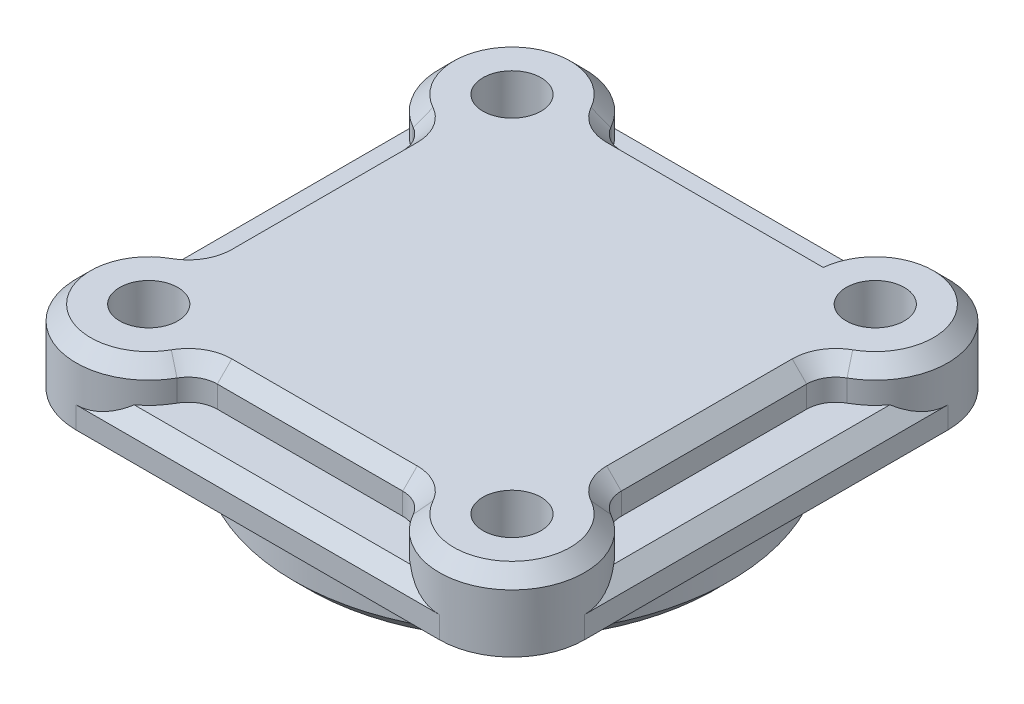
from build123d import *

# Parameters (mm, degrees)
BOSS_EXTRUDE1_DEPTH = 3.175
BOSS_EXTRUDE2_DEPTH = 3.175
SKETCH3_R           = 19.05
SKETCH3_R_2         = 15.875
BOSS_EXTRUDE3_DEPTH = 6.35
SKETCH4_R           = 2.54
CUT_EXTRUDE1_DEPTH  = 34.89972345
CHAMFER1_SIZE       = 1.27


with BuildPart() as part:
    # Sketch1 → Boss-Extrude1 (new body)
    with BuildSketch(Plane(origin=(0, 0, 0), x_dir=(1, 0, 0), z_dir=(0, 1, 0))):
        with BuildLine():
            Line((-15.875, -22.225), (15.875, -22.225))
            ThreePointArc((15.875, -22.225), (20.365128061, -20.365128061), (22.225, -15.875))
            Line((22.225, -15.875), (22.225, 15.875))
            ThreePointArc((22.225, 15.875), (20.365128061, 20.365128061), (15.875, 22.225))
            Line((15.875, 22.225), (-15.875, 22.225))
            ThreePointArc((-15.875, 22.225), (-20.365128061, 20.365128061), (-22.225, 15.875))
            Line((-22.225, 15.875), (-22.225, -15.875))
            ThreePointArc((-22.225, -15.875), (-20.365128061, -20.365128061), (-15.875, -22.225))
        make_face()
    extrude(amount=BOSS_EXTRUDE1_DEPTH)

    # Sketch2 → Boss-Extrude2 (add)
    with BuildSketch(Plane(origin=(0, 3.175, 0), x_dir=(1, 0, 0), z_dir=(0, 1, 0))):
        with BuildLine():
            Line((9.779188038, 17.653644576), (-8.104452463, 17.653644576))
            ThreePointArc((-8.104452463, 17.653644576), (-9.392376749, 18.004386475), (-10.324608902, 18.959746126))
            ThreePointArc((-10.324608902, 18.959746126), (-12.655189283, 21.348145252), (-15.875, 22.225))
            ThreePointArc((-15.875, 22.225), (-20.365128061, 20.365128061), (-22.225, 15.875))
            ThreePointArc((-22.225, 15.875), (-21.348011707, 12.654962289), (-18.959285714, 10.324353044))
            ThreePointArc((-18.959285714, 10.324353044), (-18.003795317, 9.392109345), (-17.653, 8.104094261))
            Line((-17.653, 8.104094261), (-17.653, -8.104094261))
            ThreePointArc((-17.653, -8.104094261), (-18.003795317, -9.392109345), (-18.959285714, -10.324353044))
            ThreePointArc((-18.959285714, -10.324353044), (-21.348011707, -12.654962289), (-22.225, -15.875))
            ThreePointArc((-22.225, -15.875), (-20.365128061, -20.365128061), (-15.875, -22.225))
            ThreePointArc((-15.875, -22.225), (-12.655189283, -21.348145252), (-10.324608902, -18.959746126))
            ThreePointArc((-10.324608902, -18.959746126), (-9.392376749, -18.004386475), (-8.104452463, -17.653644576))
            Line((-8.104452463, -17.653644576), (8.104452463, -17.653644576))
            ThreePointArc((8.104452463, -17.653644576), (9.392376749, -18.004386475), (10.324608902, -18.959746126))
            ThreePointArc((10.324608902, -18.959746126), (12.655189283, -21.348145252), (15.875, -22.225))
            ThreePointArc((15.875, -22.225), (20.365128061, -20.365128061), (22.225, -15.875))
            ThreePointArc((22.225, -15.875), (21.348011707, -12.654962289), (18.959285714, -10.324353044))
            ThreePointArc((18.959285714, -10.324353044), (18.003795317, -9.392109345), (17.653, -8.104094261))
            Line((17.653, -8.104094261), (17.653, 8.104094261))
            ThreePointArc((17.653, 8.104094261), (18.003795317, 9.392109345), (18.959285714, 10.324353044))
            ThreePointArc((18.959285714, 10.324353044), (21.348011707, 12.654962289), (22.225, 15.875))
            ThreePointArc((22.225, 15.875), (20.365128061, 20.365128061), (15.875, 22.225))
            ThreePointArc((15.875, 22.225), (12.065268583, 20.955201426), (9.779188038, 17.653644576))
        make_face()
    extrude(amount=BOSS_EXTRUDE2_DEPTH)

    # Sketch3 → Boss-Extrude3 (add)
    with BuildSketch(Plane.XZ):
        with Locations(Location((0, 0, 0), (0, 0, 90))):
            Circle(SKETCH3_R)
        with Locations(Location((0, 0, 0), (0, 0, 270))):
            Circle(SKETCH3_R_2, mode=Mode.SUBTRACT)
    extrude(amount=BOSS_EXTRUDE3_DEPTH)

    # Sketch4 → Cut-Extrude1 (cut, through all)
    with BuildSketch(Plane(origin=(0, 6.35, 0), x_dir=(1, 0, 0), z_dir=(0, 1, 0))):
        with Locations(Location((-15.875, 15.875, 0), (0, 0, 270))):
            Circle(SKETCH4_R)
        with Locations(Location((15.875, 15.875, 0), (0, 0, 270))):
            Circle(SKETCH4_R)
        with Locations(Location((-15.875, -15.875, 0), (0, 0, 270))):
            Circle(SKETCH4_R)
        with Locations(Location((15.875, -15.875, 0), (0, 0, 270))):
            Circle(SKETCH4_R)
    extrude(amount=-CUT_EXTRUDE1_DEPTH, mode=Mode.SUBTRACT)

    # Chamfer1
    chamfer1_edges = [part.edges().sort_by_distance(p)[0] for p in [
        (-20.365314283, 6.35, -20.36494183),
        (-20.365314283, 6.35, 20.36494183),
        (-9.392376749, 6.35, -18.004386475),
        (19.836937806, 6.35, -20.837413609),
        (0.837367788, 6.35, -17.653644576),
        (18.003795317, 6.35, -9.392109345),
        (17.653, 6.35, 0),
        (18.003795317, 6.35, 9.392109345),
        (-18.003795317, 6.35, -9.392109345),
        (20.365314283, 6.35, 20.36494183),
        (-17.653, 6.35, 0),
        (9.392376749, 6.35, 18.004386475),
        (-18.003795317, 6.35, 9.392109345),
        (0, 6.35, 17.653644576),
        (-9.392376749, 6.35, 18.004386475),
    ]]
    chamfer(chamfer1_edges, length=CHAMFER1_SIZE)
    chamfer1_2_edges = [part.edges().sort_by_distance(p)[0] for p in [
        (0, -6.35, -19.05),
    ]]
    chamfer(chamfer1_2_edges, length=CHAMFER1_SIZE)
    chamfer1_3_edges = [part.edges().sort_by_distance(p)[0] for p in [
        (0, -6.35, 15.875),
    ]]
    chamfer(chamfer1_3_edges, length=CHAMFER1_SIZE)
    # the kernel refuses this chamfer: 1.27 mm, written as the material it takes off along each edge
    with BuildSketch(Plane(origin=(-22.225, 3.175, -19.141037395), x_dir=(-0.02749587661058728, -0.9996219169112966, 0), z_dir=(0, 0, 1))) as chamfer1_4_piece_1_section:
        with BuildLine():
            Line((1.306414958, 0), (-0.071814887, 1.304439598))
            Line((-0.071814887, 1.304439598), (-0.097205283, 1.303741203))
            ThreePointArc((-0.097205283, 1.303741203), (-0.043344118, 0.652015244), (-0.025390397, -0.000698395))
            Line((-0.025390397, -0.000698395), (0.000698395, -0.025390397))
            ThreePointArc((0.000698395, -0.025390397), (0.653412034, -0.007436675), (1.307113353, -0.025390397))
            Line((1.307113353, -0.025390397), (1.306414958, 0))
        make_face()
    chamfer1_4_piece_1 = extrude(amount=38.282074789, mode=Mode.PRIVATE)
    chamfer1_4_piece_1 = chamfer1_4_piece_1 - Plane(origin=(-15.875, 2.735416382, -15.875), x_dir=(0, 0, -1), z_dir=(0, -1, 0)) * Cylinder(6.35, 82, mode=Mode.PRIVATE)
    chamfer1_4_piece_1 = chamfer1_4_piece_1 - Plane(origin=(-15.875, 2.735416382, 15.875), x_dir=(-1, 0, 0), z_dir=(0, -1, 0)) * Cylinder(6.35, 82, mode=Mode.PRIVATE)
    add(chamfer1_4_piece_1, mode=Mode.SUBTRACT)
    # the kernel refuses this chamfer: 1.27 mm, written as the material it takes off along each edge
    with BuildSketch(Plane(origin=(19.141037395, 3.175, -22.225), x_dir=(0, -0.9996219169112966, -0.02749587661058728), z_dir=(-1, 0, 0))) as chamfer1_5_piece_1_section:
        with BuildLine():
            Line((1.306414958, 0), (-0.071814887, 1.304439598))
            Line((-0.071814887, 1.304439598), (-0.097205283, 1.303741203))
            ThreePointArc((-0.097205283, 1.303741203), (-0.043344118, 0.652015244), (-0.025390397, -0.000698395))
            Line((-0.025390397, -0.000698395), (0.000698395, -0.025390397))
            ThreePointArc((0.000698395, -0.025390397), (0.653412034, -0.007436675), (1.307113353, -0.025390397))
            Line((1.307113353, -0.025390397), (1.306414958, 0))
        make_face()
    chamfer1_5_piece_1 = extrude(amount=38.282074789, mode=Mode.PRIVATE)
    chamfer1_5_piece_1 = chamfer1_5_piece_1 - Plane(origin=(-15.875, 2.735416382, -15.875), x_dir=(0, 0, -1), z_dir=(0, -1, 0)) * Cylinder(6.35, 82, mode=Mode.PRIVATE)
    chamfer1_5_piece_1 = chamfer1_5_piece_1 - Plane(origin=(15.875, 2.735416382, -15.875), x_dir=(1, 0, 0), z_dir=(0, -1, 0)) * Cylinder(6.35, 82, mode=Mode.PRIVATE)
    add(chamfer1_5_piece_1, mode=Mode.SUBTRACT)
    # the kernel refuses this chamfer: 1.27 mm, written as the material it takes off along each edge
    with BuildSketch(Plane(origin=(-19.141037395, 3.175, 22.225), x_dir=(0, -0.9996219169112966, 0.02749587661058728), z_dir=(1, 0, 0))) as chamfer1_6_piece_1_section:
        with BuildLine():
            Line((1.306414958, 0), (-0.071814887, 1.304439598))
            Line((-0.071814887, 1.304439598), (-0.097205283, 1.303741203))
            ThreePointArc((-0.097205283, 1.303741203), (-0.043344118, 0.652015244), (-0.025390397, -0.000698395))
            Line((-0.025390397, -0.000698395), (0.000698395, -0.025390397))
            ThreePointArc((0.000698395, -0.025390397), (0.653412034, -0.007436675), (1.307113353, -0.025390397))
            Line((1.307113353, -0.025390397), (1.306414958, 0))
        make_face()
    chamfer1_6_piece_1 = extrude(amount=38.282074789, mode=Mode.PRIVATE)
    chamfer1_6_piece_1 = chamfer1_6_piece_1 - Plane(origin=(-15.875, 2.735416383, 15.875), x_dir=(-1, 0, 0), z_dir=(0, -1, 0)) * Cylinder(6.35, 82, mode=Mode.PRIVATE)
    chamfer1_6_piece_1 = chamfer1_6_piece_1 - Plane(origin=(15.875, 2.735416383, 15.875), x_dir=(0, 0, 1), z_dir=(0, -1, 0)) * Cylinder(6.35, 82, mode=Mode.PRIVATE)
    add(chamfer1_6_piece_1, mode=Mode.SUBTRACT)
    # the kernel refuses this chamfer: 1.27 mm, written as the material it takes off along each edge
    with BuildSketch(Plane(origin=(22.225, 3.175, 19.141037395), x_dir=(0.02749587661058728, -0.9996219169112966, 0), z_dir=(0, 0, -1))) as chamfer1_7_piece_1_section:
        with BuildLine():
            Line((1.306414958, 0), (-0.071814887, 1.304439598))
            Line((-0.071814887, 1.304439598), (-0.097205283, 1.303741203))
            ThreePointArc((-0.097205283, 1.303741203), (-0.043344118, 0.652015244), (-0.025390397, -0.000698395))
            Line((-0.025390397, -0.000698395), (0.000698395, -0.025390397))
            ThreePointArc((0.000698395, -0.025390397), (0.653412034, -0.007436675), (1.307113353, -0.025390397))
            Line((1.307113353, -0.025390397), (1.306414958, 0))
        make_face()
    chamfer1_7_piece_1 = extrude(amount=38.282074789, mode=Mode.PRIVATE)
    chamfer1_7_piece_1 = chamfer1_7_piece_1 - Plane(origin=(15.875, 2.735416383, -15.875), x_dir=(1, 0, 0), z_dir=(0, -1, 0)) * Cylinder(6.35, 82, mode=Mode.PRIVATE)
    chamfer1_7_piece_1 = chamfer1_7_piece_1 - Plane(origin=(15.875, 2.735416383, 15.875), x_dir=(0, 0, 1), z_dir=(0, -1, 0)) * Cylinder(6.35, 82, mode=Mode.PRIVATE)
    add(chamfer1_7_piece_1, mode=Mode.SUBTRACT)


solid = part.part
